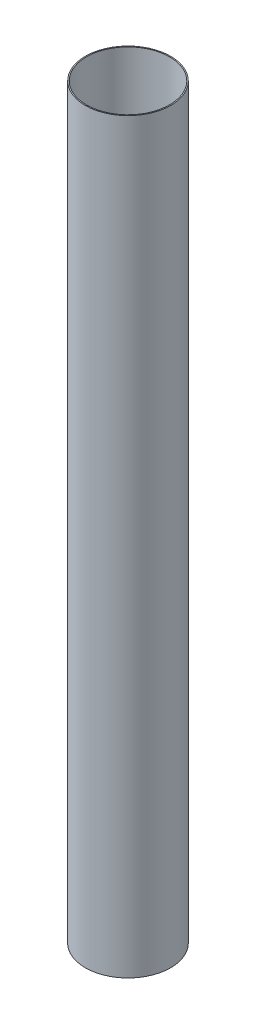
from build123d import *

# Parameters (mm, degrees)
SKETCH1_R           = 50.8
SKETCH1_R_2         = 49.53
BOSS_EXTRUDE1_DEPTH = 889


with BuildPart() as part:
    # Sketch1 → Boss-Extrude1 (new body)
    with BuildSketch(Plane(origin=(0, 0, 0), x_dir=(1, 0, 0), z_dir=(0, 1, 0))):
        Circle(SKETCH1_R)
        Circle(SKETCH1_R_2, mode=Mode.SUBTRACT)
    extrude(amount=BOSS_EXTRUDE1_DEPTH)


solid = part.part
